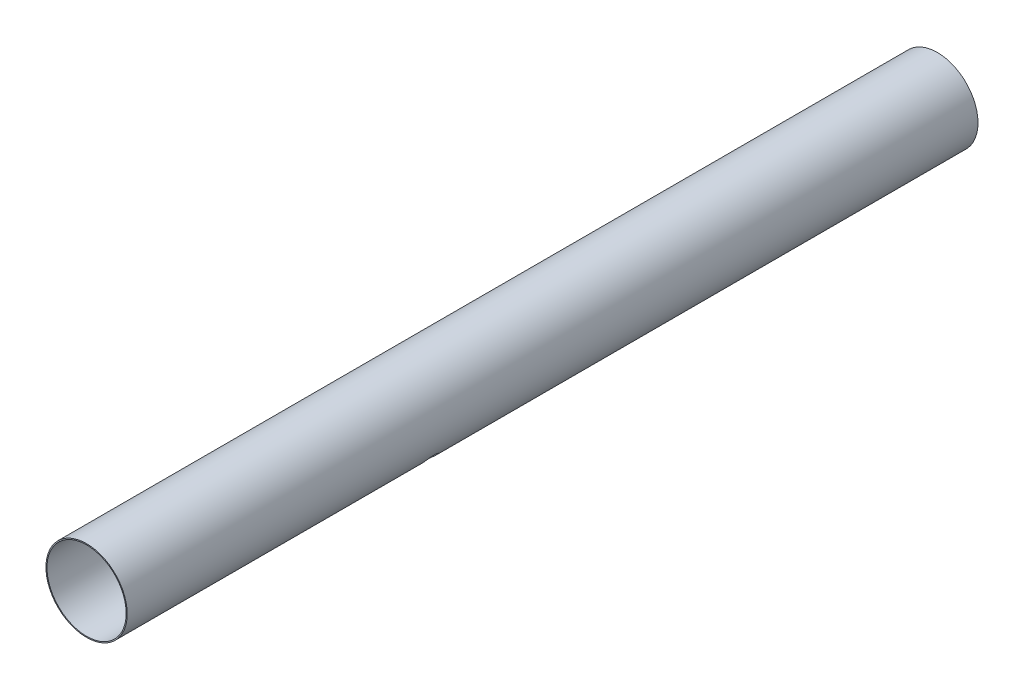
from build123d import *

# Parameters (mm, degrees)
SKETCH1_R           = 78.35
SKETCH1_R_2         = 76.35
BOSS_EXTRUDE1_DEPTH = 1640
SKETCH5_R           = 15
CUT_EXTRUDE2_DEPTH  = 1644.738861559


with BuildPart() as part:
    # Sketch1 → Boss-Extrude1 (new body)
    with BuildSketch(Plane.XY):
        Circle(SKETCH1_R)
        Circle(SKETCH1_R_2, mode=Mode.SUBTRACT)
    extrude(amount=BOSS_EXTRUDE1_DEPTH)

    # Sketch5 → Cut-Extrude2 (cut, through all)
    with BuildSketch(Plane(origin=(0, 0, 0), x_dir=(0, 0, -1), z_dir=(0.7071067811865489, -0.7071067811865462, 0))):
        with Locations((-1034.89, 0)):
            Circle(SKETCH5_R)
    extrude(amount=CUT_EXTRUDE2_DEPTH, mode=Mode.SUBTRACT)


solid = part.part
